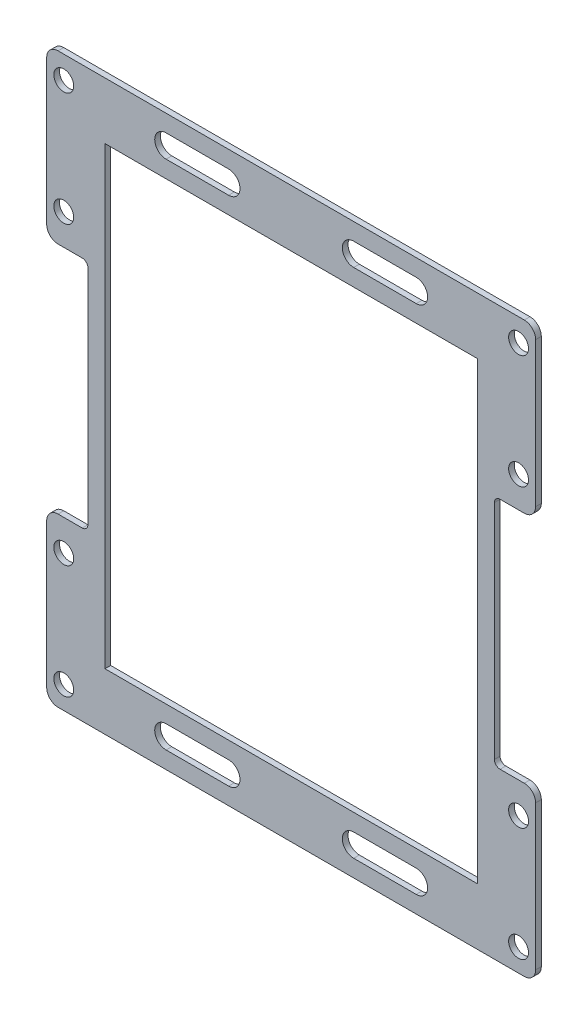
from build123d import *

# Parameters (mm, degrees)
SKETCH_1_R      = 1.75
SKETCH_1_W      = 65.5
SKETCH_1_H      = 80
EXTRUDE_1_DEPTH = 1
FILLET_1_R      = 1
FILLET_2_R      = 2


with BuildPart() as part:
    # 草圖1 → 填料-伸長1 (new body)
    with BuildSketch(Plane.XY):
        Polygon((-35.75, -20.56252042), (-43, -20.56252042), (-43, -50), (-25.75, -50), (25.75, -50), (43, -50), (43, -20.56252042), (35.75, -20.56252042), (35.75, 20.56252042), (43, 20.56252042), (43, 50), (25.75, 50), (-25.75, 50), (-43, 50), (-43, 20.56252042), (-35.75, 20.56252042), align=None)
        with Locations((-40, -26)):
            Circle(SKETCH_1_R, mode=Mode.SUBTRACT)
        with Locations((40, -26)):
            Circle(SKETCH_1_R, mode=Mode.SUBTRACT)
        with Locations((40, 26)):
            Circle(SKETCH_1_R, mode=Mode.SUBTRACT)
        with Locations((-40, 26)):
            Circle(SKETCH_1_R, mode=Mode.SUBTRACT)
        with Locations((-40, -46)):
            Circle(SKETCH_1_R, mode=Mode.SUBTRACT)
        with Locations((-40, 46)):
            Circle(SKETCH_1_R, mode=Mode.SUBTRACT)
        with Locations((40, 46)):
            Circle(SKETCH_1_R, mode=Mode.SUBTRACT)
        with Locations((40, -46)):
            Circle(SKETCH_1_R, mode=Mode.SUBTRACT)
        Rectangle(SKETCH_1_W, SKETCH_1_H, mode=Mode.SUBTRACT)
        with BuildLine():
            Line((-22, -43), (-11, -43))
            ThreePointArc((-11, -43), (-9, -45), (-11, -47))
            Line((-11, -47), (-22, -47))
            ThreePointArc((-22, -47), (-24, -45), (-22, -43))
        make_face(mode=Mode.SUBTRACT)
        with BuildLine():
            Line((22, -43), (11, -43))
            ThreePointArc((11, -43), (9, -45), (11, -47))
            Line((11, -47), (22, -47))
            ThreePointArc((22, -47), (24, -45), (22, -43))
        make_face(mode=Mode.SUBTRACT)
        with BuildLine():
            Line((22, 43), (11, 43))
            ThreePointArc((11, 43), (9, 45), (11, 47))
            Line((11, 47), (22, 47))
            ThreePointArc((22, 47), (24, 45), (22, 43))
        make_face(mode=Mode.SUBTRACT)
        with BuildLine():
            Line((-22, 43), (-11, 43))
            ThreePointArc((-11, 43), (-9, 45), (-11, 47))
            Line((-11, 47), (-22, 47))
            ThreePointArc((-22, 47), (-24, 45), (-22, 43))
        make_face(mode=Mode.SUBTRACT)
    extrude(amount=EXTRUDE_1_DEPTH)

    # 圓角1
    fillet_1_edges = [part.edges().sort_by_distance(p)[0] for p in [
        (35.75, -20.56252042, 0.5),
        (35.75, 20.56252042, 0.5),
        (-35.75, 20.56252042, 0.5),
        (-35.75, -20.56252042, 0.5),
    ]]
    fillet(fillet_1_edges, radius=FILLET_1_R)

    # 圓角2
    fillet_2_edges = [part.edges().sort_by_distance(p)[0] for p in [
        (43, 20.56252042, 0.5),
        (43, 50, 0.5),
        (-43, 50, 0.5),
        (-43, 20.56252042, 0.5),
        (-43, -20.56252042, 0.5),
        (-43, -50, 0.5),
        (43, -50, 0.5),
        (43, -20.56252042, 0.5),
    ]]
    fillet(fillet_2_edges, radius=FILLET_2_R)


solid = part.part
